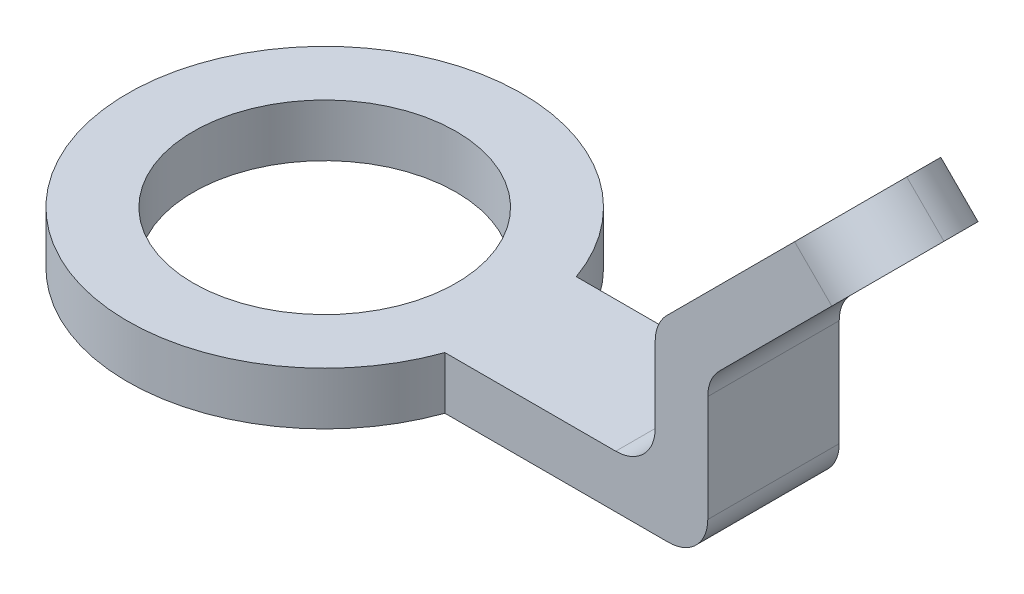
from build123d import *

# Parameters (mm, degrees)
SKETCH2_R            = 10
BOSS_EXTRUDE1_DEPTH  = 4
BOSS_EXTRUDE2_DEPTH  = 10
FILLET1_R            = 5
M3_CLEARANCE_HOLE1_D = 3.6
FILLET2_R            = 3


with BuildPart() as part:
    # Sketch2 → Boss-Extrude1 (new body)
    with BuildSketch(Plane(origin=(0, 0, 0), x_dir=(1, 0, 0), z_dir=(0, 1, 0))):
        with BuildLine():
            Line((34.142135624, 5), (34.142135624, -5))
            Line((34.142135624, -5), (14.142135624, -5))
            ThreePointArc((14.142135624, -5), (-15, 0), (14.142135624, 5))
            Line((14.142135624, 5), (34.142135624, 5))
        make_face()
        with Locations(Location((0, 0, 0), (0, 0, 270))):
            Circle(SKETCH2_R, mode=Mode.SUBTRACT)
    extrude(amount=BOSS_EXTRUDE1_DEPTH)

    # Sketch3 → Boss-Extrude2 (add)
    with BuildSketch(Plane.XY.offset(5)):
        Polygon((34.142135624, 4), (34.142135624, 12.343145751), (47.112698372, 25.313708499), (44.284271247, 28.142135624), (30.142135624, 14), (30.142135624, 4), align=None)
    extrude(amount=-BOSS_EXTRUDE2_DEPTH)

    # Fillet1
    fillet1_edges = [part.edges().sort_by_distance(p)[0] for p in [
        (45.69848481, 26.727922061, 5),
        (45.69848481, 26.727922061, -5),
    ]]
    fillet(fillet1_edges, radius=FILLET1_R - 0.0001)  # a hair under: the kernel refuses the full size

    # M3 Clearance Hole1 (through all)
    with Locations(Plane(origin=(8.071067812, -8.071067812, 0), x_dir=(0.7071067811865486, 0.7071067811865465, 0), z_dir=(-0.7071067811865465, 0.7071067811865486, 0))):
        with Locations((46.213203436, 0)):
            Hole(M3_CLEARANCE_HOLE1_D / 2)

    # Fillet2
    fillet2_edges = [part.edges().sort_by_distance(p)[0] for p in [
        (30.142135624, 4, 0),
        (30.142135624, 14, 0),
        (34.142135624, 12.343145751, 0),
        (34.142135624, 0, 0),
    ]]
    fillet(fillet2_edges, radius=FILLET2_R)


solid = part.part
